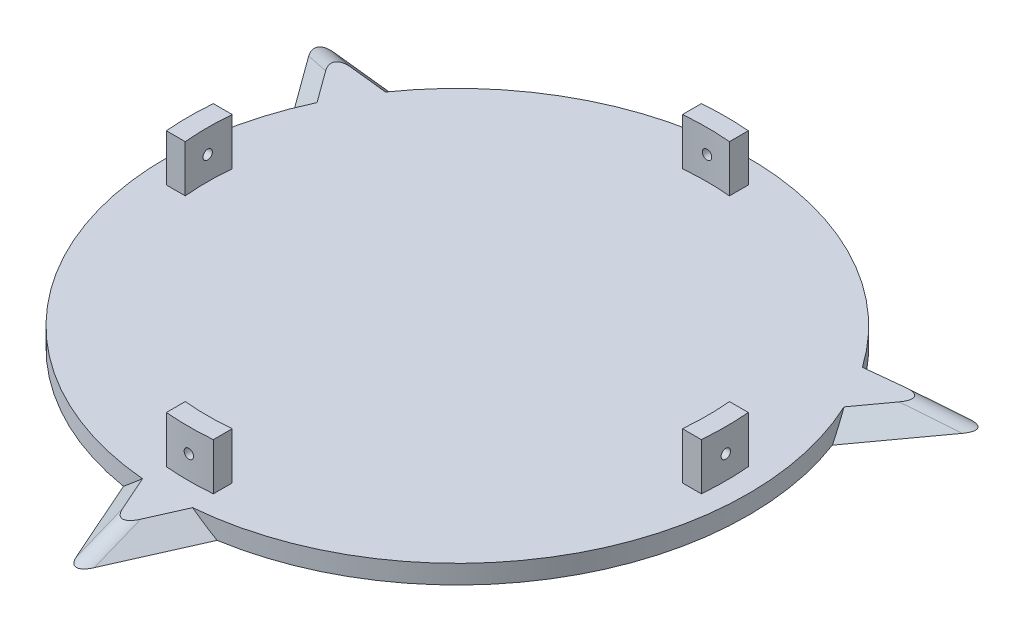
from build123d import *

# Parameters (mm, degrees)
SKETCH4_R            = 61.9125
BOSS_EXTRUDE1_DEPTH  = 4
BOSS_EXTRUDE2_DEPTH  = 10
M2_CLEARANCE_HOLE2_D = 2
M2_CLEARANCE_HOLE3_D = 2
BOSS_EXTRUDE3_DEPTH  = 4
CHAMFER1_SIZE        = 4
FILLET1_R            = 3


# Some blends are built 0.0001 mm under size
with BuildPart() as part:
    # Sketch4 → Boss-Extrude1 (new body)
    with BuildSketch(Plane(origin=(0, 0, 0), x_dir=(1, 0, 0), z_dir=(0, 1, 0))):
        with Locations(Location((0, 0, 0), (0, 0, 270))):
            Circle(SKETCH4_R)
    extrude(amount=-BOSS_EXTRUDE1_DEPTH)

    # Sketch15 → Boss-Extrude2 (add)
    with BuildSketch(Plane(origin=(0, 0, 0), x_dir=(1, 0, 0), z_dir=(0, 1, 0))):
        with BuildLine():
            Line((-52.91429391, -5), (-56.930857187, -5))
            ThreePointArc((-56.930857187, -5), (-57.15, 0), (-56.930857187, 5))
            Line((-56.930857187, 5), (-52.91429391, 5))
            ThreePointArc((-52.91429391, 5), (-53.15, 0), (-52.91429391, -5))
        make_face()
        with BuildLine():
            Line((-5, 52.91429391), (-5, 56.930857187))
            ThreePointArc((-5, 56.930857187), (0, 57.15), (5, 56.930857187))
            Line((5, 56.930857187), (5, 52.91429391))
            ThreePointArc((5, 52.91429391), (0, 53.15), (-5, 52.91429391))
        make_face()
        with BuildLine():
            Line((-5, -52.91429391), (-5, -56.930857187))
            ThreePointArc((-5, -56.930857187), (0, -57.15), (5, -56.930857187))
            Line((5, -56.930857187), (5, -52.91429391))
            ThreePointArc((5, -52.91429391), (0, -53.15), (-5, -52.91429391))
        make_face()
        with BuildLine():
            Line((52.91429391, 5), (56.930857187, 5))
            ThreePointArc((56.930857187, 5), (57.15, 0), (56.930857187, -5))
            Line((56.930857187, -5), (52.91429391, -5))
            ThreePointArc((52.91429391, -5), (53.15, 0), (52.91429391, 5))
        make_face()
    extrude(amount=BOSS_EXTRUDE2_DEPTH)

    # M2 Clearance Hole2 (through all)
    with Locations(Plane(origin=(0, 5, 57.15), x_dir=(1, 0, 0), z_dir=(0, 0, 1))):
        with Locations((0, 0)):
            Hole(M2_CLEARANCE_HOLE2_D / 2)

    # M2 Clearance Hole3 (through all)
    with Locations(Plane(origin=(57.15, 5, 0), x_dir=(0, 0, 1), z_dir=(1, 0, 0))):
        with Locations((0, 0)):
            Hole(M2_CLEARANCE_HOLE3_D / 2)

    # Sketch19 → Boss-Extrude3 (add)
    with BuildSketch(Plane(origin=(0, 0, 0), x_dir=(1, 0, 0), z_dir=(0, 1, 0))):
        with BuildLine():
            Line((9.967336465, -61.104908641), (0, -83.564835105))
            Line((0, -83.564835105), (-9.967336465, -61.104908641))
            ThreePointArc((-9.967336465, -61.104908641), (0, -61.9125), (9.967336465, -61.104908641))
        make_face()
        with BuildLine():
            Line((-47.934734947, 39.184420907), (-72.369270064, 41.782417553))
            Line((-72.369270064, 41.782417553), (-57.902071411, 21.920487734))
            ThreePointArc((-57.902071411, 21.920487734), (-53.617797812, 30.95625), (-47.934734947, 39.184420907))
        make_face()
        with BuildLine():
            Line((57.902071411, 21.920487734), (72.369270064, 41.782417553))
            Line((72.369270064, 41.782417553), (47.934734947, 39.184420907))
            ThreePointArc((47.934734947, 39.184420907), (53.617797812, 30.95625), (57.902071411, 21.920487734))
        make_face()
    extrude(amount=-BOSS_EXTRUDE3_DEPTH)

    # Chamfer1
    chamfer1_edges = [part.edges().sort_by_distance(p)[0] for p in [
        (-60.152002506, 0, -40.48341923),
        (-65.135670738, 0, -31.851452643),
        (60.152002506, 0, -40.48341923),
        (65.135670738, 0, -31.851452643),
        (4.983668232, 0, 72.334871873),
        (-4.983668232, 0, 72.334871873),
    ]]
    chamfer(chamfer1_edges, length=CHAMFER1_SIZE - 0.0001)  # a hair under: the kernel refuses the full size

    # Fillet1
    # the kernel refuses this fillet: 3 mm, written as the material it takes off along each edge
    with BuildSketch(Plane(origin=(-58.731491813, 2.387836055, -33.908642608), x_dir=(-0.1711376698055133, -0.5989233275147531, 0.7823060435227348), z_dir=(-0.8025159588326043, -0.3758867485808155, -0.46333280486096456)), Plane(origin=(58.731491813, 2.387836055, -33.908642608), x_dir=(-0.5919280723220329, -0.5989233275147517, -0.5393625913574092), z_dir=(0.80251595883259, -0.3758867485808147, -0.4633328048609902))) as fillet1_piece_1:
        with BuildLine():
            CenterArc((FILLET1_R * 0.847005492593, -FILLET1_R), FILLET1_R, 90, 80.529565024)
            Line((-FILLET1_R * 0.139365143358, -FILLET1_R * 0.835461346383), (0, 0))
            Line((0, 0), (FILLET1_R * 0.847005492593, 0))
        make_face()
    extrude(amount=23.346319451, mode=Mode.SUBTRACT)
    with BuildSketch(Plane(origin=(0, 2.387836055, 67.817285216), x_dir=(-0.7630657421275423, -0.5989233275147525, -0.24294345216531282), z_dir=(0, -0.37588674858081544, 0.9266656097219444))) as fillet1_piece_2:
        with BuildLine():
            CenterArc((FILLET1_R * 0.847005492593, FILLET1_R), FILLET1_R, 189.470434976, 80.529565024)
            Line((-FILLET1_R * 0.139365143358, FILLET1_R * 0.835461346383), (0, 0))
            Line((0, 0), (FILLET1_R * 0.847005492593, 0))
        make_face()
    extrude(amount=23.346319451, mode=Mode.SUBTRACT)


solid = part.part
